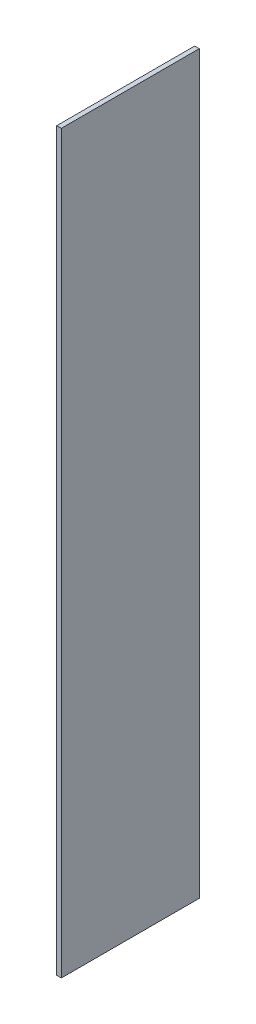
from build123d import *

# Parameters (mm, degrees)
SKETCH1_W           = 0.1
SKETCH1_H           = 16
BOSS_EXTRUDE1_DEPTH = 3


with BuildPart() as part:
    # Sketch1 → Boss-Extrude1 (new body)
    with BuildSketch(Plane.XY):
        with Locations((0.05, 8)):
            Rectangle(SKETCH1_W, SKETCH1_H)
    extrude(amount=BOSS_EXTRUDE1_DEPTH)


solid = part.part
